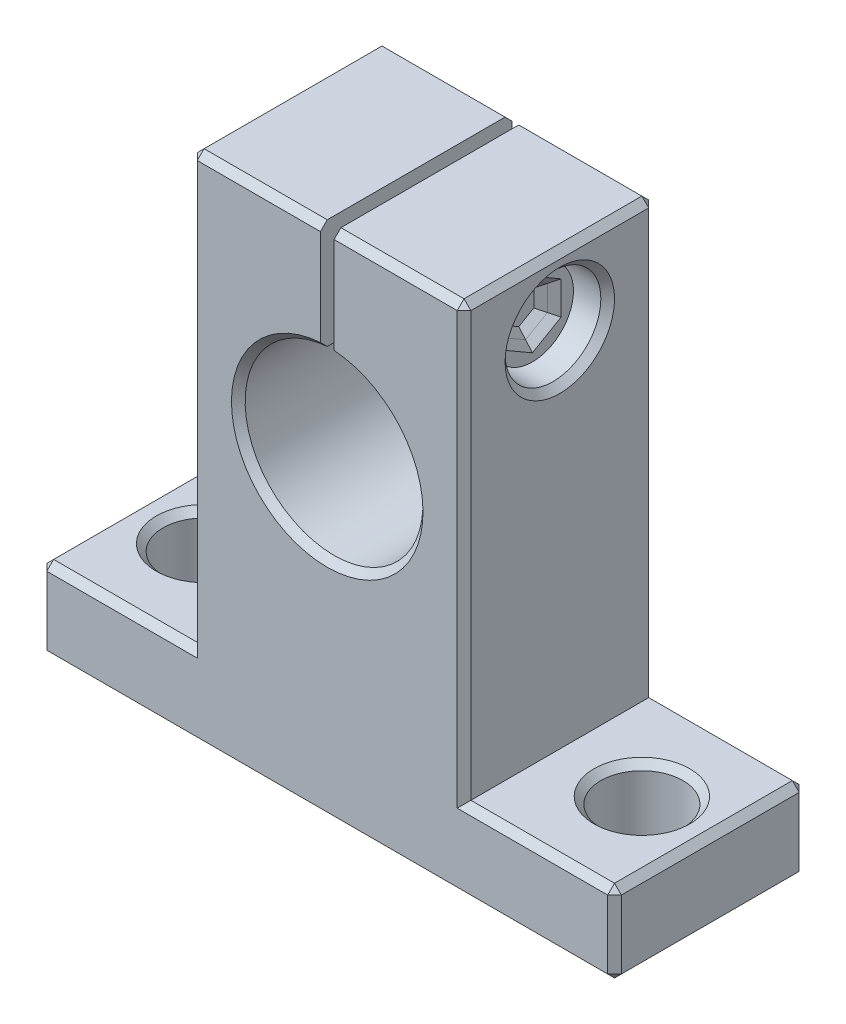
from build123d import *

# Parameters (mm, degrees)
SKETCH_1_W           = 42
SKETCH_1_H           = 14
SKETCH_1_R           = 3
EXTRUDE_1_DEPTH      = 6
SKETCH_2_W           = 20
SKETCH_2_H           = 14
EXTRUDE_2_DEPTH      = 31.5
CUT_EXTRUDE_1_DEPTH  = 37.5
SKETCH_5_R           = 3.5
CUT_EXTRUDE_2_DEPTH  = 2
SKETCH_6_R           = 3.5
SKETCH_6_R_2         = 3
CUT_EXTRUDE_3_DEPTH  = 1
EXTRUDE_3_DEPTH      = 1
EXTRUDE_3_DEPTH_BACK = 15
SKETCH_7_R           = 1.5
SKETCH_8_R           = 1.8
SKETCH_8_R_2         = 1.5
CUT_EXTRUDE_4_DEPTH  = 0.5
CHAMFER_1_SIZE       = 0.5
CHAMFER_2_SIZE       = 0.5
CHAMFER_3_SIZE       = 0.5
CHAMFER_4_SIZE       = 0.5


with BuildPart() as part:
    # 草图1 → 凸台-拉伸1 (new body)
    with BuildSketch(Plane(origin=(0, 0, 0), x_dir=(1, 0, 0), z_dir=(0, 1, 0))):
        with Locations((21, 7)):
            Rectangle(SKETCH_1_W, SKETCH_1_H)
        with Locations(Location((5, 7, 0), (0, 0, 270))):
            Circle(SKETCH_1_R, mode=Mode.SUBTRACT)
        with Locations(Location((37, 7, 0), (0, 0, 270))):
            Circle(SKETCH_1_R, mode=Mode.SUBTRACT)
    extrude(amount=EXTRUDE_1_DEPTH)

    # 草图2 → 凸台-拉伸2 (add)
    with BuildSketch(Plane(origin=(0, 6, 0), x_dir=(1, 0, 0), z_dir=(0, 1, 0))):
        with Locations((21, 7)):
            Rectangle(SKETCH_2_W, SKETCH_2_H)
    extrude(amount=EXTRUDE_2_DEPTH)

    # 草图3 → 切除-拉伸1 (cut)
    with BuildSketch(Plane.XY):
        with BuildLine():
            Line((21.5, 29.480740698), (21.5, 37.5))
            Line((21.5, 37.5), (20.5, 37.5))
            Line((20.5, 37.5), (20.5, 29.480740698))
            ThreePointArc((20.5, 29.480740698), (21, 16.5), (21.5, 29.480740698))
        make_face()
    extrude(amount=-CUT_EXTRUDE_1_DEPTH, mode=Mode.SUBTRACT)

    # 草图5 → 切除-拉伸2 (cut)
    with BuildSketch(Plane(origin=(31, 0, 0), x_dir=(0, 0, -1), z_dir=(1, 0, 0))):
        with Locations((7, 32.5)):
            Circle(SKETCH_5_R)
    extrude(amount=-CUT_EXTRUDE_2_DEPTH, mode=Mode.SUBTRACT)

    # 草图6 → 切除-拉伸3 (cut)
    # profile 1 of 2: a face of its own
    with BuildSketch(Plane(origin=(29, 0, 0), x_dir=(0, 0, -1), z_dir=(1, 0, 0))):
        with Locations((7, 32.5)):
            Circle(SKETCH_6_R)
        with Locations((7, 32.5)):
            Circle(SKETCH_6_R_2, mode=Mode.SUBTRACT)
    # profile 2 of 2: a face of its own
    with BuildSketch(Plane(origin=(29, 0, 0), x_dir=(0, 0, -1), z_dir=(1, 0, 0))):
        Polygon((5.401923789, 31.577350269), (5.401923789, 33.422649731), (7, 34.345299462), (8.598076211, 33.422649731), (8.598076211, 31.577350269), (7, 30.654700538), align=None)
    extrude(amount=-CUT_EXTRUDE_3_DEPTH, mode=Mode.SUBTRACT)

    # 草图7 → 凸台-拉伸3 (add, two sides: drawn at the far end of the back side and taken through both)
    with BuildSketch(Plane.ZY.offset(-11).offset(-EXTRUDE_3_DEPTH_BACK)):
        with Locations((-7, 32.5)):
            Circle(SKETCH_7_R)
    extrude(amount=EXTRUDE_3_DEPTH + EXTRUDE_3_DEPTH_BACK)

    # 草图8 → 切除-拉伸4 (cut)
    with BuildSketch(Plane.ZY.offset(-11)):
        with Locations((-7, 32.5)):
            Circle(SKETCH_8_R)
        with Locations((-7, 32.5)):
            Circle(SKETCH_8_R_2, mode=Mode.SUBTRACT)
    extrude(amount=-CUT_EXTRUDE_4_DEPTH, mode=Mode.SUBTRACT)

    # 倒角1
    chamfer_1_edges = [part.edges().sort_by_distance(p)[0] for p in [
        (11, 32.5, -8.8),
    ]]
    chamfer(chamfer_1_edges, length=CHAMFER_1_SIZE - 0.0001)  # a hair under: the kernel refuses the full size

    # 倒角2
    chamfer_2_edges = [part.edges().sort_by_distance(p)[0] for p in [
        (31, 32.5, -3.5),
    ]]
    chamfer(chamfer_2_edges, length=CHAMFER_2_SIZE)

    # 倒角3
    chamfer_3_edges = [part.edges().sort_by_distance(p)[0] for p in [
        (29, 31.116025404, -7.799038106),
        (29, 32.5, -8.598076211),
        (29, 33.883974596, -7.799038106),
        (29, 33.883974596, -6.200961894),
        (29, 32.5, -5.401923789),
        (29, 31.116025404, -6.200961894),
        (28, 33.883974596, -6.200961894),
        (28, 33.883974596, -7.799038106),
        (28, 32.5, -8.598076211),
        (28, 31.116025404, -7.799038106),
        (28, 31.116025404, -6.200961894),
        (28, 32.5, -5.401923789),
    ]]
    chamfer(chamfer_3_edges, length=CHAMFER_3_SIZE - 0.0001)  # a hair under: the kernel refuses the full size

    # 倒角4
    chamfer_4_edges = [part.edges().sort_by_distance(p)[0] for p in [
        (21, 16.5, 0),
        (21, 16.5, -14),
        (0, 0, -7),
        (0, 6, -7),
        (11, 37.5, -7),
        (31, 37.5, -7),
        (42, 6, -7),
        (15.75, 37.5, 0),
        (11, 21.75, 0),
        (5.5, 6, 0),
        (0, 3, 0),
        (21, 0, 0),
        (26.25, 37.5, 0),
        (31, 21.75, 0),
        (36.5, 6, 0),
        (42, 3, 0),
        (42, 0, -7),
        (26.25, 37.5, -14),
        (31, 21.75, -14),
        (36.5, 6, -14),
        (42, 3, -14),
        (21, 0, -14),
        (0, 3, -14),
        (5.5, 6, -14),
        (11, 21.75, -14),
        (15.75, 37.5, -14),
        (37, 0, -10),
        (37, 6, -10),
        (5, 0, -10),
        (5, 6, -10),
    ]]
    chamfer(chamfer_4_edges, length=CHAMFER_4_SIZE)


solid = part.part
